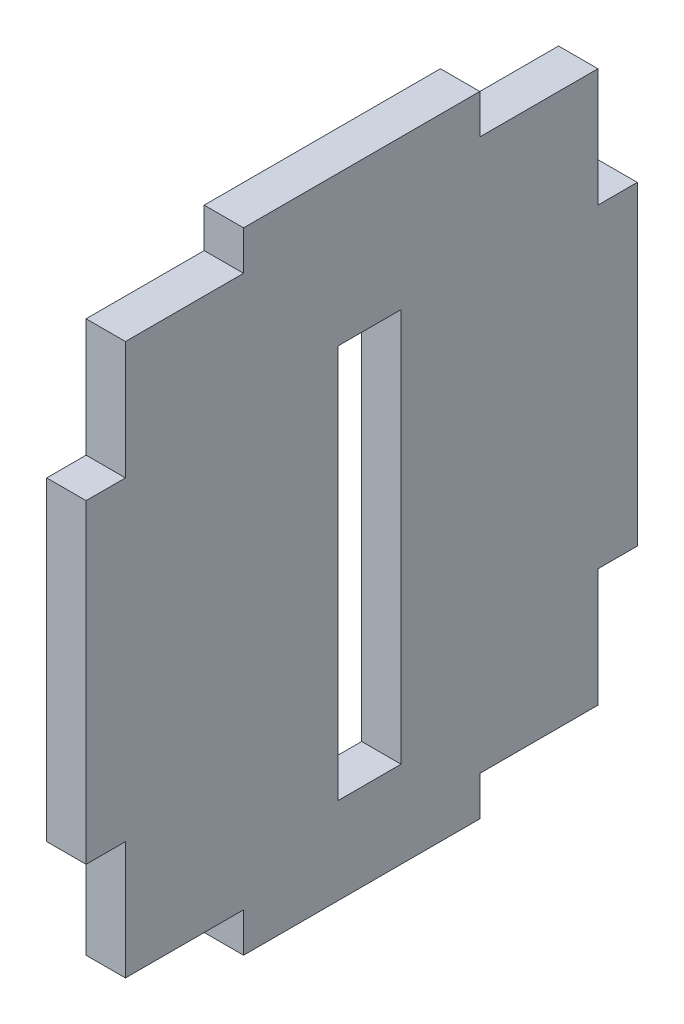
from build123d import *

# Parameters (mm, degrees)
SKETCH1_W                                = 70
SKETCH1_H                                = 80
BOSS_EXTRUDE1_DEPTH                      = 5
CUT_EXTRUDE1_DEPTH                       = 54.38539126
MIRROR1_AT_THE_SECOND_PLANE_COPY_1_DEPTH = 54.38539126
CUT_EXTRUDE2_DEPTH                       = 54.38539126
CUT_EXTRUDE2_DEPTH_BACK                  = 54.38539126
SKETCH4_W                                = 8
SKETCH4_H                                = 50


with BuildPart() as part:
    # Sketch1 → Boss-Extrude1 (new body)
    with BuildSketch(Plane(origin=(0, 0, 0), x_dir=(0, 0, -1), z_dir=(1, 0, 0))):
        Rectangle(SKETCH1_W, SKETCH1_H)
    extrude(amount=BOSS_EXTRUDE1_DEPTH)

    # Sketch3 → Cut-Extrude1 (cut, symmetric)
    with BuildSketch(Plane(origin=(5, 0, 0), x_dir=(0, 0, -1), z_dir=(1, 0, 0))):
        Polygon((-35, 20), (-30, 20), (-30, 35), (-15, 35), (-15, 40), (-35, 40), align=None)
    cut_extrude1 = extrude(amount=CUT_EXTRUDE1_DEPTH, both=True, mode=Mode.SUBTRACT)

    # Mirror1: Cut-Extrude1 across plane
    add(cut_extrude1.mirror(Plane.XY), mode=Mode.SUBTRACT)

    # Mirror1 at the second plane: Cut-Extrude1 across plane
    add(cut_extrude1.mirror(Plane.ZX), mode=Mode.SUBTRACT)

    # Mirror1 at the second plane copy 1 sketc → Mirror1 at the second plane copy 1 (cut, symmetric)
    with BuildSketch(Plane(origin=(5, 0, 0), x_dir=(0, 0, 1), z_dir=(1, 0, 0))):
        Polygon((-35, 20), (-30, 20), (-30, 35), (-15, 35), (-15, 40), (-35, 40), align=None)
    extrude(amount=MIRROR1_AT_THE_SECOND_PLANE_COPY_1_DEPTH, both=True, mode=Mode.SUBTRACT)

    # Sketch4 → Cut-Extrude2 (cut, two sides: drawn at the far end of the back side and taken through both)
    with BuildSketch(Plane(origin=(5, 0, 0), x_dir=(0, 0, -1), z_dir=(1, 0, 0)).offset(-CUT_EXTRUDE2_DEPTH_BACK)):
        with Locations((1, -3.988080063)):
            Rectangle(SKETCH4_W, SKETCH4_H)
    extrude(amount=CUT_EXTRUDE2_DEPTH + CUT_EXTRUDE2_DEPTH_BACK, mode=Mode.SUBTRACT)


solid = part.part
